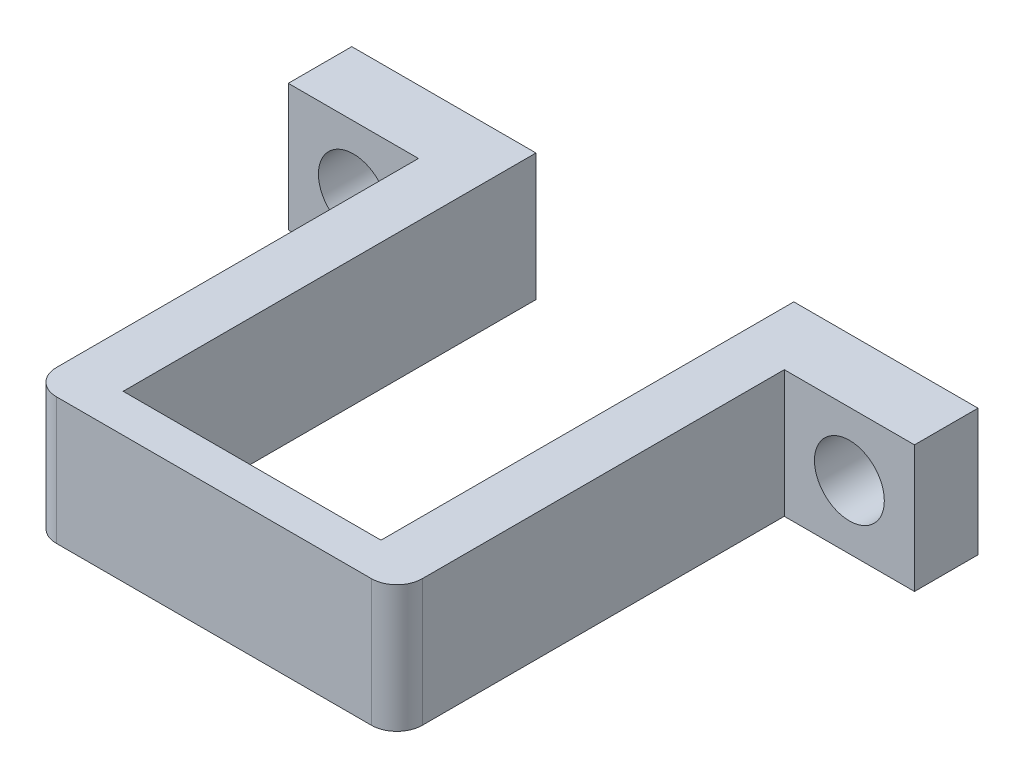
from build123d import *
from build123d.topology import SkipClean

# Parameters (mm, degrees)
SKETCH2_W             = 4.25
SKETCH2_H             = 10
BOSS_EXTRUDE1_DEPTH   = 32.5
BOSS_EXTRUDE1_2_DEPTH = 32.5
SKETCH3_W             = 28.8
SKETCH3_H             = 10
BOSS_EXTRUDE2_DEPTH   = 3
SKETCH4_W             = 8.25
SKETCH4_H             = 10
SKETCH4_W_2           = 12.5
SKETCH4_W_3           = 4.25
BOSS_EXTRUDE3_DEPTH   = 3
SKETCH5_W             = 2
SKETCH5_H             = 10
BOSS_EXTRUDE4_DEPTH   = 3
CUT_EXTRUDE1_DEPTH    = 3
SKETCH7_W             = 10.25
SKETCH7_H             = 10
SKETCH7_R             = 2.75
BOSS_EXTRUDE5_DEPTH   = 2
FILLET1_R             = 2


with BuildPart() as part:
    # Sketch2 → Boss-Extrude1 (new body)
    with BuildSketch(Plane.XY):
        with Locations((-12.275, -59.5)):
            Rectangle(SKETCH2_W, SKETCH2_H)
    extrude(amount=BOSS_EXTRUDE1_DEPTH)



with BuildPart() as body_2:
    # Sketch2 → Boss-Extrude1 2 (new body)
    with BuildSketch(Plane.XY):
        with Locations((12.275, -59.5)):
            Rectangle(SKETCH2_W, SKETCH2_H)
    extrude(amount=BOSS_EXTRUDE1_2_DEPTH)


with BuildPart() as part_1:
    add(part.part)

    add(body_2.part)  # Boss-Extrude2 merges body 2
    # Sketch3 → Boss-Extrude2 (add)
    with BuildSketch(Plane.XY.offset(32.5)):
        with Locations((0, -59.5)):
            Rectangle(SKETCH3_W, SKETCH3_H)
    extrude(amount=BOSS_EXTRUDE2_DEPTH)

    # Sketch4 → Boss-Extrude3 (add)
    with BuildSketch(Plane(origin=(0, 0, 0), x_dir=(-1, 0, 0), z_dir=(0, 0, -1))):
        with Locations((18.525, -59.5)):
            Rectangle(SKETCH4_W, SKETCH4_H)
        with Locations((-16.4, -59.5)):
            Rectangle(SKETCH4_W_2, SKETCH4_H)
        with Locations((12.275, -59.5)):
            Rectangle(SKETCH4_W_3, SKETCH4_H)
    extrude(amount=-BOSS_EXTRUDE3_DEPTH)

    # Sketch5 → Boss-Extrude4 (add)
    with BuildSketch(Plane(origin=(0, 0, 0), x_dir=(-1, 0, 0), z_dir=(0, 0, -1))):
        with Locations((23.65, -59.5)):
            Rectangle(SKETCH5_W, SKETCH5_H)
        with Locations((-23.65, -59.5)):
            Rectangle(SKETCH5_W, SKETCH5_H)
    extrude(amount=-BOSS_EXTRUDE4_DEPTH)

    # Sketch6 → Cut-Extrude1 (cut)
    with BuildSketch(Plane(origin=(0, 0, 0), x_dir=(-1, 0, 0), z_dir=(0, 0, -1))):
        with BuildLine():
            ThreePointArc((22.275, -59.5), (20.561677147, -56.952883887), (17.556599642, -57.579609407))
            Line((17.556599642, -57.579609407), (21.493400358, -61.420390593))
            ThreePointArc((21.493400358, -61.420390593), (22.072116113, -60.536677147), (22.275, -59.5))
        make_face()
        with BuildLine():
            Line((21.493400358, -61.420390593), (17.556599642, -57.579609407))
            ThreePointArc((17.556599642, -57.579609407), (17.604609407, -61.468400358), (21.493400358, -61.420390593))
        make_face()
        with BuildLine():
            ThreePointArc((-16.775, -59.5), (-16.977883887, -58.463322853), (-17.556599642, -57.579609407))
            Line((-17.556599642, -57.579609407), (-21.493400358, -61.420390593))
            ThreePointArc((-21.493400358, -61.420390593), (-18.488322853, -62.047116113), (-16.775, -59.5))
        make_face()
        with BuildLine():
            Line((-21.493400358, -61.420390593), (-17.556599642, -57.579609407))
            ThreePointArc((-17.556599642, -57.579609407), (-21.445390593, -57.531599642), (-21.493400358, -61.420390593))
        make_face()
    extrude(amount=-CUT_EXTRUDE1_DEPTH, mode=Mode.SUBTRACT)

    # Sketch7 → Boss-Extrude5 (add)
    # profile 1 of 2: a face of its own
    with SkipClean():  # the faces are left unmerged after this step: merging them gives an invalid solid
        with BuildSketch(Plane.XY.offset(3)):
            with Locations((-19.525, -59.5)):
                Rectangle(SKETCH7_W, SKETCH7_H)
            with Locations(Location((-19.525, -59.5, 0), (0, 0, 180))):
                Circle(SKETCH7_R, mode=Mode.SUBTRACT)
        # profile 2 of 2: a face of its own
        with BuildSketch(Plane.XY.offset(3)):
            with Locations((19.525, -59.5)):
                Rectangle(SKETCH7_W, SKETCH7_H)
            with Locations(Location((19.525, -59.5, 0), (0, 0, 180))):
                Circle(SKETCH7_R, mode=Mode.SUBTRACT)
        extrude(amount=BOSS_EXTRUDE5_DEPTH)
    add(part_1.part.scale(1), mode=Mode.REPLACE)  # the faces are merged on a copy

    # Fillet1
    fillet1_edges = [part_1.edges().sort_by_distance(p)[0] for p in [
        (14.4, -59.5, 35.5),
        (-14.4, -59.5, 35.5),
    ]]
    fillet(fillet1_edges, radius=FILLET1_R)


solid = part_1.part
